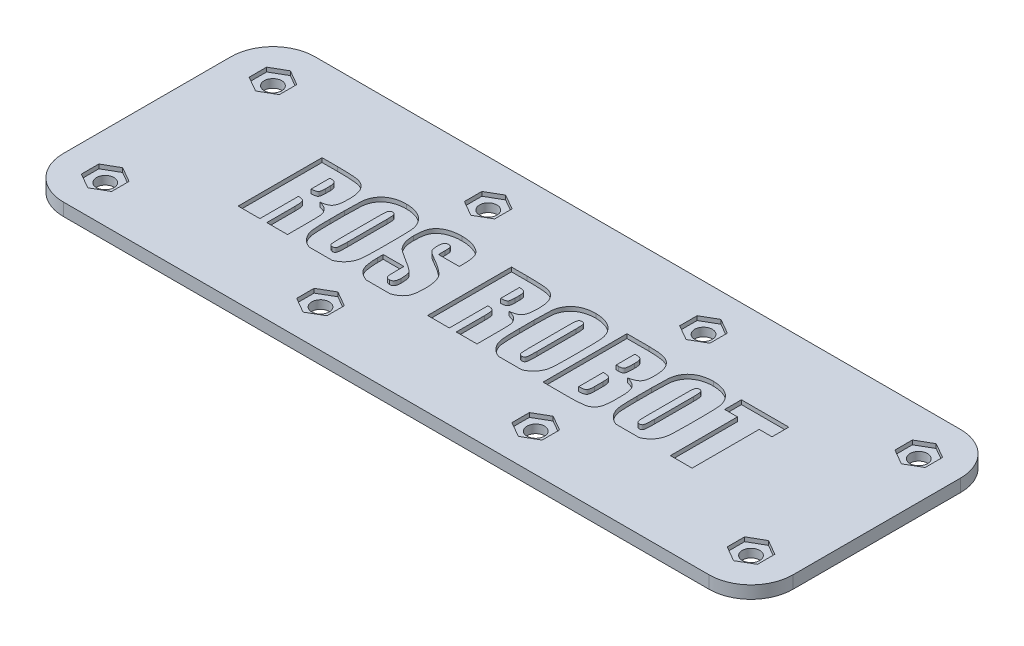
from build123d import *

# Parameters (mm, degrees)
SKETCH1_W           = 174
SKETCH1_H           = 60
BOSS_EXTRUDE1_DEPTH = 3
SKETCH2_R           = 2.09
CUT_EXTRUDE1_DEPTH  = 93.076055519
FILLET1_R           = 10
CUT_EXTRUDE2_DEPTH  = 1
CUT_EXTRUDE3_DEPTH  = 1


with BuildPart() as part:
    # Sketch1 → Boss-Extrude1 (new body)
    with BuildSketch(Plane(origin=(0, 0, 0), x_dir=(1, 0, 0), z_dir=(0, 1, 0))):
        Rectangle(SKETCH1_W, SKETCH1_H)
    extrude(amount=BOSS_EXTRUDE1_DEPTH)

    # Sketch2 → Cut-Extrude1 (cut, through all)
    with BuildSketch(Plane(origin=(0, 3, 0), x_dir=(1, 0, 0), z_dir=(0, 1, 0))):
        with Locations((-76.995, 20)):
            Circle(SKETCH2_R)
        with Locations((-25.665, 20)):
            Circle(SKETCH2_R)
        with Locations((25.665, 20)):
            Circle(SKETCH2_R)
        with Locations((76.995, 20)):
            Circle(SKETCH2_R)
    cut_extrude1 = extrude(amount=-CUT_EXTRUDE1_DEPTH, mode=Mode.SUBTRACT)

    # Mirror1: Cut-Extrude1 across plane
    add(cut_extrude1.mirror(Plane.XY), mode=Mode.SUBTRACT)

    # Fillet1
    fillet1_edges = [part.edges().sort_by_distance(p)[0] for p in [
        (-87, 1.5, 30),
        (87, 1.5, 30),
        (87, 1.5, -30),
        (-87, 1.5, -30),
    ]]
    fillet(fillet1_edges, radius=FILLET1_R)

    # Sketch3 → Cut-Extrude2 (cut)
    # profile 1 of 8: a face of its own
    with BuildSketch(Plane(origin=(0, 3, 0), x_dir=(1, 0, 0), z_dir=(0, 1, 0))):
        with BuildLine():
            Line((-55.294117647, 10), (-55.294117647, -10))
            Line((-55.294117647, -10), (-50.117647059, -10))
            Line((-50.117647059, -10), (-50.117647059, -0.823529412))
            add(Edge.make_bspline(
                [(-48.470588235, -3.235294118), (-48.472761242, -2.989057045), (-48.472387298, -2.639023284), (-48.505158342, -2.198133437), (-48.532479629, -1.92557618), (-48.569704298, -1.691279038), (-48.610487711, -1.495733015), (-48.665731057, -1.339045986), (-48.72892158, -1.214559745), (-48.811250352, -1.114048439), (-48.923249449, -1.039006456), (-49.055008244, -0.967790447), (-49.216553319, -0.913344326), (-49.404406892, -0.87518001), (-49.706887916, -0.834016934), (-49.948360167, -0.824906739), (-50.117647059, -0.823529412)],
                knots=[0, 0, 0, 0, 0.208712059, 0.296134584, 0.374433717, 0.440652749, 0.497064647, 0.543362023, 0.580977914, 0.614871505, 0.652040686, 0.69429784, 0.741574127, 0.795734674, 0.856514492, 1, 1, 1, 1], degree=3))
            Line((-48.470588235, -3.235294118), (-48.470588235, -10))
            Line((-48.470588235, -10), (-43.529411765, -10))
            Line((-43.529411765, -10), (-43.529411765, -4.658088235))
            add(Edge.make_bspline(
                [(-46.408088235, 0.573529412), (-46.169175195, 0.50822747), (-45.822797374, 0.415734606), (-45.392366575, 0.25367086), (-45.117566143, 0.123930771), (-44.870917189, -0.007492588), (-44.65785979, -0.150360385), (-44.475013905, -0.301624252), (-44.280128786, -0.508899378), (-44.084325942, -0.769865918), (-43.889130105, -1.074726742), (-43.748038737, -1.369657122), (-43.665206597, -1.619897087), (-43.628706333, -1.846302243), (-43.597806292, -2.071507013), (-43.579140796, -2.357697691), (-43.560358753, -2.703267668), (-43.546626536, -3.107776257), (-43.529565282, -3.765806928), (-43.534845869, -4.289262628), (-43.529411765, -4.658088235)],
                knots=[0, 0, 0, 0, 0.110230182, 0.159227155, 0.204340897, 0.245320208, 0.283417653, 0.318243371, 0.350628895, 0.409719639, 0.463107288, 0.511383408, 0.554826309, 0.579739697, 0.613274558, 0.655916727, 0.707227072, 0.767225961, 0.835926031, 1, 1, 1, 1], degree=3))
            add(Edge.make_bspline(
                [(-43.529411765, 4.617647059), (-43.523559379, 4.265343442), (-43.547444952, 3.759926021), (-43.602480895, 3.118174034), (-43.67103257, 2.70757313), (-43.748929488, 2.343067112), (-43.846868698, 2.023021074), (-43.966655354, 1.751430904), (-44.105783368, 1.520874413), (-44.274381424, 1.32692517), (-44.474656502, 1.156423758), (-44.713189671, 1.010798238), (-44.984161555, 0.881436662), (-45.289554301, 0.77180459), (-45.764929016, 0.650898651), (-46.14354858, 0.594911695), (-46.408088235, 0.573529412)],
                knots=[0, 0, 0, 0, 0.183790359, 0.264137372, 0.336086755, 0.400975565, 0.458649469, 0.51049186, 0.555594521, 0.598692018, 0.644079697, 0.692369191, 0.744168131, 0.800636925, 0.861471696, 1, 1, 1, 1], degree=3))
            add(Edge.make_bspline(
                [(-51.566176471, 10), (-50.993819944, 10.002073268), (-50.173782937, 9.992522011), (-49.130967301, 9.961770188), (-48.461579038, 9.934349846), (-47.867125834, 9.893765625), (-47.348485673, 9.846902044), (-46.905287107, 9.793813546), (-46.526534008, 9.727924289), (-46.192709029, 9.642203621), (-45.884608598, 9.529610049), (-45.589803188, 9.3956181), (-45.311726309, 9.228198446), (-45.052332013, 9.031642664), (-44.802348856, 8.815602269), (-44.574834978, 8.564597704), (-44.355921653, 8.290441128), (-44.158035206, 7.977684947), (-43.990685169, 7.6226227), (-43.847046859, 7.226287928), (-43.730527587, 6.786918244), (-43.640302786, 6.30511939), (-43.54780148, 5.579003966), (-43.534831682, 5.009887783), (-43.529411765, 4.617647059)],
                knots=[0, 0, 0, 0, 0.148881435, 0.213302999, 0.271376625, 0.323137581, 0.368275921, 0.406826982, 0.439217091, 0.468211877, 0.496345732, 0.524443445, 0.552325136, 0.580568943, 0.609027807, 0.638127546, 0.668547056, 0.700208954, 0.734143472, 0.770447799, 0.809729999, 0.852243566, 0.897872275, 1, 1, 1, 1], degree=3))
            Line((-51.566176471, 10), (-55.294117647, 10))
        make_face()
        with BuildLine():
            Line((-50.117647059, 2.235294118), (-50.117647059, 6.705882353))
            add(Edge.make_bspline(
                [(-48.470588235, 5.154411765), (-48.473249493, 5.418336948), (-48.491488459, 5.788234319), (-48.648984539, 6.208983424), (-48.813415334, 6.422021915), (-49.050216126, 6.552252293), (-49.479623299, 6.691331049), (-49.853765331, 6.700787332), (-50.117647059, 6.705882353)],
                knots=[0, 0, 0, 0, 0.296724354, 0.405999103, 0.497474067, 0.590179394, 0.702696619, 1, 1, 1, 1], degree=3))
            Line((-48.470588235, 5.154411765), (-48.470588235, 4.047794118))
            add(Edge.make_bspline(
                [(-50.117647059, 2.235294118), (-49.857557508, 2.233760348), (-49.495937601, 2.254180117), (-49.069683976, 2.35845805), (-48.867432147, 2.445644692), (-48.745704681, 2.557108502), (-48.667446357, 2.67024801), (-48.608188606, 2.82039897), (-48.557138221, 3.001544455), (-48.518214815, 3.215789117), (-48.475786771, 3.567218376), (-48.476158421, 3.849445469), (-48.470588235, 4.047794118)],
                knots=[0, 0, 0, 0, 0.263190412, 0.361520604, 0.442777778, 0.481272857, 0.526534855, 0.58025477, 0.643242407, 0.716208439, 0.799608844, 1, 1, 1, 1], degree=3))
        make_face(mode=Mode.SUBTRACT)
    # profile 2 of 8: a face of its own
    with BuildSketch(Plane(origin=(0, 3, 0), x_dir=(1, 0, 0), z_dir=(0, 1, 0))):
        Polygon((47.764705882, 6), (47.764705882, -10), (52.941176471, -10), (52.941176471, 6), (56, 6), (56, 10), (44.705882353, 10), (44.705882353, 6), align=None)
    # profile 3 of 8: a face of its own
    with BuildSketch(Plane(origin=(0, 3, 0), x_dir=(1, 0, 0), z_dir=(0, 1, 0))):
        with BuildLine():
            add(Edge.make_bspline(
                [(34.787591886, -10), (34.741761761, -9.982163901), (34.487009891, -9.879507335), (34.042846164, -9.665315535), (33.497596942, -9.294141109), (33.004837153, -8.868283302), (32.590244195, -8.369291591), (32.241200285, -7.832606995), (31.970326867, -7.264803658), (31.7770156, -6.675518554), (31.680811824, -6.158697296), (31.640781616, -5.707416893), (31.61144965, -5.309067923), (31.58644099, -4.851864522), (31.563600779, -4.338406349), (31.550537462, -3.765971588), (31.534960472, -2.887325956), (31.530709234, -2.198537053), (31.529411765, -1.720588235)],
                knots=[0.225245668, 0.225245668, 0.225245668, 0.225245668, 0.237119462, 0.291547555, 0.344026935, 0.396061673, 0.448382925, 0.500209986, 0.550407591, 0.599943185, 0.649656355, 0.677028621, 0.709391549, 0.746167788, 0.787661399, 0.833573904, 0.884512765, 1, 1, 1, 1], degree=3))
            Line((34.787591886, -10), (40.270546503, -10))
            add(Edge.make_bspline(
                [(43.529411765, -1.720588235), (43.524977386, -2.187493055), (43.527485684, -2.861564549), (43.513659007, -3.723176582), (43.492592589, -4.286757999), (43.477437693, -4.794372306), (43.450537902, -5.247761941), (43.421891662, -5.646171759), (43.380347347, -6.101647454), (43.294542618, -6.624914293), (43.107920451, -7.219511222), (42.843367666, -7.785177502), (42.511311791, -8.321353326), (42.105777244, -8.812589913), (41.63007521, -9.246149672), (41.088724326, -9.619888631), (40.6233363, -9.856872129), (40.342702819, -9.972014325), (40.270546503, -10)],
                knots=[0, 0, 0, 0, 0.112808662, 0.162854343, 0.208179017, 0.249065094, 0.285542064, 0.317901769, 0.345566, 0.396043361, 0.445675688, 0.495616157, 0.546553387, 0.597655569, 0.64900077, 0.701564226, 0.756120432, 0.774811337, 0.774811337, 0.774811337, 0.774811337], degree=3))
            Line((43.529411765, -1.720588235), (43.529411765, 1.720588235))
            add(Edge.make_bspline(
                [(37.529411765, 10.470588235), (38.038894684, 10.469671201), (38.788681402, 10.412760966), (39.744529245, 10.186217725), (40.401636425, 9.955436447), (41.013529114, 9.66465689), (41.560592921, 9.296369489), (42.050185177, 8.866806687), (42.465386921, 8.369636901), (42.81304053, 7.831558235), (43.089397703, 7.265823377), (43.281884485, 6.674250061), (43.378475362, 6.156263525), (43.416575366, 5.70476117), (43.453946296, 5.308199355), (43.470219128, 4.85167531), (43.496202826, 4.338451088), (43.506675236, 3.76590889), (43.533077201, 2.887460762), (43.521820892, 2.198445293), (43.529411765, 1.720588235)],
                knots=[0, 0, 0, 0, 0.123202067, 0.180742519, 0.236944207, 0.291252849, 0.34398818, 0.39581077, 0.448142032, 0.499979007, 0.550314461, 0.599859532, 0.649873316, 0.677250819, 0.709347809, 0.74611558, 0.787617129, 0.833538417, 0.884493047, 1, 1, 1, 1], degree=3))
            add(Edge.make_bspline(
                [(31.529411765, 1.720588235), (31.533991052, 2.188713716), (31.531108159, 2.862798648), (31.545386018, 3.724392091), (31.565702585, 4.286786515), (31.583100426, 4.795440173), (31.603076752, 5.249142813), (31.633848772, 5.647343808), (31.67399175, 6.101980465), (31.765594143, 6.624508136), (31.95074402, 7.219419898), (32.214264902, 7.784810836), (32.550091288, 8.318154077), (32.951446724, 8.814087979), (33.43222548, 9.243388483), (33.97014504, 9.621689493), (34.57743305, 9.926923969), (35.239660206, 10.175524458), (36.224684229, 10.407114958), (36.999322768, 10.475980227), (37.529411765, 10.470588235)],
                knots=[0, 0, 0, 0, 0.113099886, 0.162847397, 0.208170127, 0.249054449, 0.28580995, 0.317873, 0.345536044, 0.396062444, 0.445692641, 0.495630967, 0.546314995, 0.597643479, 0.649205395, 0.701523382, 0.756077247, 0.812941755, 0.872040704, 1, 1, 1, 1], degree=3))
            Line((31.529411765, 1.720588235), (31.529411765, -1.720588235))
        make_face()
        with BuildLine():
            Line((36.705882353, -4.566176471), (36.705882353, 4.959558824))
            add(Edge.make_bspline(
                [(37.555147059, 7.176470588), (37.428868031, 7.182797441), (37.24390046, 7.138559035), (37.035758608, 7.000683728), (36.931909138, 6.877108883), (36.862948919, 6.744569909), (36.822456095, 6.603411175), (36.785646052, 6.425261242), (36.758957365, 6.207467331), (36.73117098, 5.951569919), (36.715299821, 5.530700778), (36.703487212, 5.196283974), (36.705882353, 4.959558824)],
                knots=[0, 0, 0, 0, 0.141272891, 0.207933505, 0.278501019, 0.320511285, 0.375555263, 0.443280697, 0.525522512, 0.622694993, 0.733336158, 1, 1, 1, 1], degree=3))
            add(Edge.make_bspline(
                [(38.352941176, 4.959558824), (38.352264386, 5.175303354), (38.346448336, 5.482932653), (38.333448647, 5.871602904), (38.314251231, 6.115480155), (38.292601849, 6.32757554), (38.26906515, 6.508580133), (38.235892117, 6.655852623), (38.190248925, 6.805984555), (38.106307017, 6.954005969), (37.907812734, 7.143059215), (37.690491789, 7.172463444), (37.555147059, 7.176470588)],
                knots=[0, 0, 0, 0, 0.245381507, 0.350013726, 0.44228014, 0.523562531, 0.592561096, 0.649714338, 0.695120491, 0.770678918, 0.840725622, 1, 1, 1, 1], degree=3))
            Line((38.352941176, 4.959558824), (38.352941176, -4.415441176))
            add(Edge.make_bspline(
                [(37.518382353, -7.176470588), (37.66995262, -7.179093019), (37.905890797, -7.129538142), (38.118964553, -6.90767097), (38.197795186, -6.727494998), (38.244746358, -6.545832046), (38.270782318, -6.363169473), (38.296907257, -6.140135689), (38.319120243, -5.875330263), (38.331807954, -5.568704581), (38.347878308, -5.07734288), (38.351487943, -4.688733938), (38.352941176, -4.415441176)],
                knots=[0, 0, 0, 0, 0.145035585, 0.209346918, 0.281953002, 0.327186926, 0.385477675, 0.455016533, 0.53818829, 0.634996402, 0.743261766, 1, 1, 1, 1], degree=3))
            add(Edge.make_bspline(
                [(36.705882353, -4.566176471), (36.710406485, -4.834553498), (36.707612663, -5.215756676), (36.721256936, -5.695131762), (36.742396681, -5.990199181), (36.757088503, -6.243241553), (36.783640941, -6.454082367), (36.811484319, -6.62251498), (36.851258818, -6.78643941), (36.933796701, -6.945563097), (37.144434325, -7.143111825), (37.373741892, -7.175688722), (37.518382353, -7.176470588)],
                knots=[0, 0, 0, 0, 0.263965983, 0.374910105, 0.471520145, 0.554902094, 0.624118814, 0.680393612, 0.722784308, 0.789641701, 0.853612109, 1, 1, 1, 1], degree=3))
        make_face(mode=Mode.SUBTRACT)
    # profile 4 of 8: a face of its own
    with BuildSketch(Plane(origin=(0, 3, 0), x_dir=(1, 0, 0), z_dir=(0, 1, 0))):
        with BuildLine():
            Line((17.411764706, 10), (17.411764706, -10))
            Line((17.411764706, -10), (23.492647059, -10))
            add(Edge.make_bspline(
                [(29.647058824, -5.242647059), (29.646934914, -5.56266215), (29.63497194, -6.026795982), (29.584977204, -6.622276843), (29.53416178, -7.01986255), (29.468709895, -7.384541811), (29.388508503, -7.716304337), (29.293798242, -8.015418252), (29.149573113, -8.363197067), (28.927560807, -8.74691581), (28.580556243, -9.13068276), (28.16551384, -9.437763787), (27.757437565, -9.624746944), (27.37556001, -9.732935722), (27.017915035, -9.80554901), (26.59446752, -9.866667644), (26.10218982, -9.911528453), (25.545803904, -9.952303985), (24.668406884, -9.993965557), (23.976672129, -9.994581299), (23.492647059, -10)],
                knots=[0, 0, 0, 0, 0.102249571, 0.148224941, 0.190863369, 0.230259752, 0.266534441, 0.299841642, 0.330380545, 0.386717901, 0.440498022, 0.494529809, 0.550587574, 0.582802206, 0.621195561, 0.667097519, 0.719418425, 0.779085769, 0.845327487, 1, 1, 1, 1], degree=3))
            Line((29.647058824, -5.242647059), (29.647058824, -3.363970588))
            add(Edge.make_bspline(
                [(26.632352941, 0.941176471), (26.906401285, 0.878367085), (27.300653812, 0.765704813), (27.787692795, 0.562963036), (28.106692167, 0.402419875), (28.388685462, 0.220959582), (28.635442208, 0.022849809), (28.848962578, -0.191232265), (29.023773677, -0.428407061), (29.173198265, -0.68773403), (29.30233921, -0.975620533), (29.406624653, -1.296799727), (29.495483711, -1.649218696), (29.564266695, -2.032454679), (29.628905941, -2.607265288), (29.645716704, -3.054823478), (29.647058824, -3.363970588)],
                knots=[0, 0, 0, 0, 0.144065397, 0.209341867, 0.269975095, 0.326732211, 0.380743663, 0.431785064, 0.481119172, 0.531178616, 0.584838818, 0.642398889, 0.703899801, 0.770874214, 0.841643912, 1, 1, 1, 1], degree=3))
            add(Edge.make_bspline(
                [(29.411764706, 4.393382353), (29.416072307, 4.126960997), (29.396065876, 3.74315812), (29.335162444, 3.256001615), (29.279024495, 2.936656591), (29.198004913, 2.651763218), (29.102620539, 2.397408381), (28.989683638, 2.175311926), (28.854039324, 1.981642317), (28.690429234, 1.812181884), (28.495593314, 1.657001481), (28.269341956, 1.510833787), (28.006048053, 1.37965403), (27.71371462, 1.248439101), (27.252486443, 1.096633591), (26.888805185, 0.993582451), (26.632352941, 0.941176471)],
                knots=[0, 0, 0, 0, 0.159593497, 0.229911515, 0.294149678, 0.353664097, 0.407125896, 0.456720642, 0.50256341, 0.548270697, 0.597357213, 0.651540418, 0.709344876, 0.773469607, 0.843372266, 1, 1, 1, 1], degree=3))
            add(Edge.make_bspline(
                [(22.716911765, 10), (23.110299522, 9.995507602), (23.681885346, 9.991990426), (24.418574897, 9.952815753), (24.913450102, 9.906680869), (25.371467166, 9.85836305), (25.790704796, 9.791308442), (26.172459453, 9.715347075), (26.520787705, 9.627485478), (26.84146812, 9.519137488), (27.144180179, 9.391831518), (27.429336701, 9.235748238), (27.697604709, 9.054575482), (27.953304968, 8.851805073), (28.191702458, 8.62386534), (28.413756391, 8.371324932), (28.621706622, 8.093999736), (28.812626294, 7.782522973), (28.973440584, 7.426443305), (29.107426233, 7.026703693), (29.222906801, 6.585043099), (29.303426476, 6.098623186), (29.390288895, 5.365364626), (29.415704121, 4.790976826), (29.411764706, 4.393382353)],
                knots=[0, 0, 0, 0, 0.114402272, 0.166147642, 0.214440873, 0.258905608, 0.300029633, 0.337835121, 0.3720588, 0.404397908, 0.436166631, 0.467419606, 0.498747648, 0.530188964, 0.562196583, 0.594510161, 0.627862043, 0.662877889, 0.700506647, 0.74118522, 0.785347679, 0.833090934, 0.884403879, 1, 1, 1, 1], degree=3))
            Line((22.716911765, 10), (17.411764706, 10))
        make_face()
        with BuildLine():
            Line((22.588235294, -6.705882353), (22.588235294, -0.823529412))
            add(Edge.make_bspline(
                [(24.470588235, -2.783088235), (24.469862246, -2.581049271), (24.468263551, -2.292776904), (24.427029649, -1.932486797), (24.404272556, -1.709794577), (24.356722032, -1.522790473), (24.308770024, -1.366819262), (24.246387911, -1.243993471), (24.173743985, -1.146988974), (24.074721587, -1.077498638), (23.954129928, -1.015414588), (23.799805517, -0.965596267), (23.616507623, -0.922557764), (23.402762748, -0.886516164), (23.057457797, -0.845450875), (22.782095648, -0.830589633), (22.588235294, -0.823529412)],
                knots=[0, 0, 0, 0, 0.182450376, 0.259089149, 0.327073499, 0.383894219, 0.4328162, 0.473836669, 0.507662291, 0.540813339, 0.581833808, 0.629708737, 0.686529456, 0.751567122, 0.825033248, 1, 1, 1, 1], degree=3))
            Line((24.470588235, -2.783088235), (24.470588235, -4.746323529))
            add(Edge.make_bspline(
                [(22.588235294, -6.705882353), (22.772111176, -6.697406963), (23.035946818, -6.686457893), (23.366082308, -6.639035107), (23.574317755, -6.600446567), (23.754734821, -6.548534402), (23.909241043, -6.49114772), (24.037582, -6.426347928), (24.139518515, -6.345276863), (24.219828968, -6.242534291), (24.290452462, -6.116974085), (24.343026299, -5.957931043), (24.390391907, -5.772581816), (24.426658548, -5.55735456), (24.460433346, -5.212848849), (24.475325771, -4.93910161), (24.470588235, -4.746323529)],
                knots=[0, 0, 0, 0, 0.168587072, 0.241054147, 0.305044923, 0.362185481, 0.412580102, 0.455716051, 0.493190485, 0.530664919, 0.574336739, 0.624343173, 0.683356267, 0.749349201, 0.823767794, 1, 1, 1, 1], degree=3))
        make_face(mode=Mode.SUBTRACT)
        with BuildLine():
            Line((22.588235294, 2.235294118), (22.588235294, 6.705882353))
            add(Edge.make_bspline(
                [(24.470588235, 4.794117647), (24.472484496, 5.063219136), (24.456102942, 5.432680133), (24.377118595, 5.876003573), (24.290960876, 6.108918073), (24.185117865, 6.287925027), (24.065630734, 6.427443722), (23.932108439, 6.534581277), (23.771096212, 6.604626256), (23.56915719, 6.646964309), (23.171954505, 6.69359434), (22.835840675, 6.701690154), (22.588235294, 6.705882353)],
                knots=[0, 0, 0, 0, 0.247893338, 0.340015611, 0.413628261, 0.475403061, 0.530639967, 0.582137883, 0.631666993, 0.690827129, 0.771639487, 1, 1, 1, 1], degree=3))
            add(Edge.make_bspline(
                [(23.161764706, 2.246323529), (23.394028214, 2.2431048), (23.720403071, 2.271138301), (24.083618428, 2.440239428), (24.230880072, 2.592576437), (24.301784115, 2.75375132), (24.348188684, 2.915615042), (24.382075121, 3.121889263), (24.415674107, 3.370608152), (24.440054223, 3.665115429), (24.465440646, 4.144235023), (24.470464317, 4.52570717), (24.470588235, 4.794117647)],
                knots=[0, 0, 0, 0, 0.207123309, 0.283931547, 0.350841284, 0.389256939, 0.439128512, 0.499893306, 0.574453467, 0.661745219, 0.761896218, 1, 1, 1, 1], degree=3))
            add(Edge.make_bspline(
                [(22.588235294, 2.235294118), (22.874959549, 2.242972169), (23.161764706, 2.246323529)],
                knots=[0, 0, 0, 1, 1, 1], degree=2))
        make_face(mode=Mode.SUBTRACT)
    # profile 5 of 8: a face of its own
    with BuildSketch(Plane(origin=(0, 3, 0), x_dir=(1, 0, 0), z_dir=(0, 1, 0))):
        with BuildLine():
            add(Edge.make_bspline(
                [(6.787591886, -10), (6.741761761, -9.982163901), (6.487009891, -9.879507335), (6.042846164, -9.665315535), (5.497596942, -9.294141109), (5.004837153, -8.868283302), (4.590244195, -8.369291591), (4.241200285, -7.832606995), (3.970326867, -7.264803658), (3.7770156, -6.675518554), (3.680811824, -6.158697296), (3.640781616, -5.707416893), (3.61144965, -5.309067923), (3.58644099, -4.851864522), (3.563600779, -4.338406349), (3.550537462, -3.765971588), (3.534960472, -2.887325956), (3.530709234, -2.198537053), (3.529411765, -1.720588235)],
                knots=[0.225245668, 0.225245668, 0.225245668, 0.225245668, 0.237119462, 0.291547555, 0.344026935, 0.396061673, 0.448382925, 0.500209986, 0.550407591, 0.599943185, 0.649656355, 0.677028621, 0.709391549, 0.746167788, 0.787661399, 0.833573904, 0.884512765, 1, 1, 1, 1], degree=3))
            Line((6.787591886, -10), (12.270546503, -10))
            add(Edge.make_bspline(
                [(15.529411765, -1.720588235), (15.524977386, -2.187493055), (15.527485684, -2.861564549), (15.513659007, -3.723176582), (15.492592589, -4.286757999), (15.477437693, -4.794372306), (15.450537902, -5.247761941), (15.421891662, -5.646171759), (15.380347347, -6.101647454), (15.294542618, -6.624914293), (15.107920451, -7.219511222), (14.843367666, -7.785177502), (14.511311791, -8.321353326), (14.105777244, -8.812589913), (13.63007521, -9.246149672), (13.088724326, -9.619888631), (12.6233363, -9.856872129), (12.342702819, -9.972014325), (12.270546503, -10)],
                knots=[0, 0, 0, 0, 0.112808662, 0.162854343, 0.208179017, 0.249065094, 0.285542064, 0.317901769, 0.345566, 0.396043361, 0.445675688, 0.495616157, 0.546553387, 0.597655569, 0.64900077, 0.701564226, 0.756120432, 0.774811337, 0.774811337, 0.774811337, 0.774811337], degree=3))
            Line((15.529411765, -1.720588235), (15.529411765, 1.720588235))
            add(Edge.make_bspline(
                [(9.529411765, 10.470588235), (10.038894684, 10.469671201), (10.788681402, 10.412760966), (11.744529245, 10.186217725), (12.401636425, 9.955436447), (13.013529114, 9.66465689), (13.560592921, 9.296369489), (14.050185177, 8.866806687), (14.465386921, 8.369636901), (14.81304053, 7.831558235), (15.089397703, 7.265823377), (15.281884485, 6.674250061), (15.378475362, 6.156263525), (15.416575366, 5.70476117), (15.453946296, 5.308199355), (15.470219128, 4.85167531), (15.496202826, 4.338451088), (15.506675236, 3.76590889), (15.533077201, 2.887460762), (15.521820892, 2.198445293), (15.529411765, 1.720588235)],
                knots=[0, 0, 0, 0, 0.123202067, 0.180742519, 0.236944207, 0.291252849, 0.34398818, 0.39581077, 0.448142032, 0.499979007, 0.550314461, 0.599859532, 0.649873316, 0.677250819, 0.709347809, 0.74611558, 0.787617129, 0.833538417, 0.884493047, 1, 1, 1, 1], degree=3))
            add(Edge.make_bspline(
                [(3.529411765, 1.720588235), (3.533991052, 2.188713716), (3.531108159, 2.862798648), (3.545386018, 3.724392091), (3.565702585, 4.286786515), (3.583100426, 4.795440173), (3.603076752, 5.249142813), (3.633848772, 5.647343808), (3.67399175, 6.101980465), (3.765594143, 6.624508136), (3.95074402, 7.219419898), (4.214264902, 7.784810836), (4.550091288, 8.318154077), (4.951446724, 8.814087979), (5.43222548, 9.243388483), (5.97014504, 9.621689493), (6.57743305, 9.926923969), (7.239660206, 10.175524458), (8.224684229, 10.407114958), (8.999322768, 10.475980227), (9.529411765, 10.470588235)],
                knots=[0, 0, 0, 0, 0.113099886, 0.162847397, 0.208170127, 0.249054449, 0.28580995, 0.317873, 0.345536044, 0.396062444, 0.445692641, 0.495630967, 0.546314995, 0.597643479, 0.649205395, 0.701523382, 0.756077247, 0.812941755, 0.872040704, 1, 1, 1, 1], degree=3))
            Line((3.529411765, 1.720588235), (3.529411765, -1.720588235))
        make_face()
        with BuildLine():
            Line((8.705882353, -4.566176471), (8.705882353, 4.959558824))
            add(Edge.make_bspline(
                [(9.555147059, 7.176470588), (9.428868031, 7.182797441), (9.24390046, 7.138559035), (9.035758608, 7.000683728), (8.931909138, 6.877108883), (8.862948919, 6.744569909), (8.822456095, 6.603411175), (8.785646052, 6.425261242), (8.758957365, 6.207467331), (8.73117098, 5.951569919), (8.715299821, 5.530700778), (8.703487212, 5.196283974), (8.705882353, 4.959558824)],
                knots=[0, 0, 0, 0, 0.141272891, 0.207933505, 0.278501019, 0.320511285, 0.375555263, 0.443280697, 0.525522512, 0.622694993, 0.733336158, 1, 1, 1, 1], degree=3))
            add(Edge.make_bspline(
                [(10.352941176, 4.959558824), (10.352264386, 5.175303354), (10.346448336, 5.482932653), (10.333448647, 5.871602904), (10.314251231, 6.115480155), (10.292601849, 6.32757554), (10.26906515, 6.508580133), (10.235892117, 6.655852623), (10.190248925, 6.805984555), (10.106307017, 6.954005969), (9.907812734, 7.143059215), (9.690491789, 7.172463444), (9.555147059, 7.176470588)],
                knots=[0, 0, 0, 0, 0.245381507, 0.350013726, 0.44228014, 0.523562531, 0.592561096, 0.649714338, 0.695120491, 0.770678918, 0.840725622, 1, 1, 1, 1], degree=3))
            Line((10.352941176, 4.959558824), (10.352941176, -4.415441176))
            add(Edge.make_bspline(
                [(9.518382353, -7.176470588), (9.66995262, -7.179093019), (9.905890797, -7.129538142), (10.118964553, -6.90767097), (10.197795186, -6.727494998), (10.244746358, -6.545832046), (10.270782318, -6.363169473), (10.296907257, -6.140135689), (10.319120243, -5.875330263), (10.331807954, -5.568704581), (10.347878308, -5.07734288), (10.351487943, -4.688733938), (10.352941176, -4.415441176)],
                knots=[0, 0, 0, 0, 0.145035585, 0.209346918, 0.281953002, 0.327186926, 0.385477675, 0.455016533, 0.53818829, 0.634996402, 0.743261766, 1, 1, 1, 1], degree=3))
            add(Edge.make_bspline(
                [(8.705882353, -4.566176471), (8.710406485, -4.834553498), (8.707612663, -5.215756676), (8.721256936, -5.695131762), (8.742396681, -5.990199181), (8.757088503, -6.243241553), (8.783640941, -6.454082367), (8.811484319, -6.62251498), (8.851258818, -6.78643941), (8.933796701, -6.945563097), (9.144434325, -7.143111825), (9.373741892, -7.175688722), (9.518382353, -7.176470588)],
                knots=[0, 0, 0, 0, 0.263965983, 0.374910105, 0.471520145, 0.554902094, 0.624118814, 0.680393612, 0.722784308, 0.789641701, 0.853612109, 1, 1, 1, 1], degree=3))
        make_face(mode=Mode.SUBTRACT)
    # profile 6 of 8: a face of its own
    with BuildSketch(Plane(origin=(0, 3, 0), x_dir=(1, 0, 0), z_dir=(0, 1, 0))):
        with BuildLine():
            Line((-10.117647059, 10), (-10.117647059, -10))
            Line((-10.117647059, -10), (-4.941176471, -10))
            Line((-4.941176471, -10), (-4.941176471, -0.823529412))
            add(Edge.make_bspline(
                [(-3.294117647, -3.235294118), (-3.296290654, -2.989057045), (-3.295916709, -2.639023284), (-3.328687754, -2.198133437), (-3.356009041, -1.92557618), (-3.39323371, -1.691279038), (-3.434017123, -1.495733015), (-3.489260469, -1.339045986), (-3.552450992, -1.214559745), (-3.634779763, -1.114048439), (-3.74677886, -1.039006456), (-3.878537656, -0.967790447), (-4.040082731, -0.913344326), (-4.227936304, -0.87518001), (-4.530417327, -0.834016934), (-4.771889579, -0.824906739), (-4.941176471, -0.823529412)],
                knots=[0, 0, 0, 0, 0.208712059, 0.296134584, 0.374433717, 0.440652749, 0.497064647, 0.543362023, 0.580977914, 0.614871505, 0.652040686, 0.69429784, 0.741574127, 0.795734674, 0.856514492, 1, 1, 1, 1], degree=3))
            Line((-3.294117647, -3.235294118), (-3.294117647, -10))
            Line((-3.294117647, -10), (1.647058824, -10))
            Line((1.647058824, -10), (1.647058824, -4.658088235))
            add(Edge.make_bspline(
                [(-1.231617647, 0.573529412), (-0.992704607, 0.50822747), (-0.646326786, 0.415734606), (-0.215895987, 0.25367086), (0.058904445, 0.123930771), (0.3055534, -0.007492588), (0.518610798, -0.150360385), (0.701456683, -0.301624252), (0.896341803, -0.508899378), (1.092144646, -0.769865918), (1.287340483, -1.074726742), (1.428431851, -1.369657122), (1.511263992, -1.619897087), (1.547764255, -1.846302243), (1.578664296, -2.071507013), (1.597329792, -2.357697691), (1.616111835, -2.703267668), (1.629844053, -3.107776257), (1.646905306, -3.765806928), (1.641624719, -4.289262628), (1.647058824, -4.658088235)],
                knots=[0, 0, 0, 0, 0.110230182, 0.159227155, 0.204340897, 0.245320208, 0.283417653, 0.318243371, 0.350628895, 0.409719639, 0.463107288, 0.511383408, 0.554826309, 0.579739697, 0.613274558, 0.655916727, 0.707227072, 0.767225961, 0.835926031, 1, 1, 1, 1], degree=3))
            add(Edge.make_bspline(
                [(1.647058824, 4.617647059), (1.652911209, 4.265343442), (1.629025636, 3.759926021), (1.573989693, 3.118174034), (1.505438018, 2.70757313), (1.4275411, 2.343067112), (1.32960189, 2.023021074), (1.209815234, 1.751430904), (1.070687221, 1.520874413), (0.902089165, 1.32692517), (0.701814086, 1.156423758), (0.463280917, 1.010798238), (0.192309033, 0.881436662), (-0.113083713, 0.77180459), (-0.588458428, 0.650898651), (-0.967077992, 0.594911695), (-1.231617647, 0.573529412)],
                knots=[0, 0, 0, 0, 0.183790359, 0.264137372, 0.336086755, 0.400975565, 0.458649469, 0.51049186, 0.555594521, 0.598692018, 0.644079697, 0.692369191, 0.744168131, 0.800636925, 0.861471696, 1, 1, 1, 1], degree=3))
            add(Edge.make_bspline(
                [(-6.389705882, 10), (-5.817349355, 10.002073268), (-4.997312349, 9.992522011), (-3.954496712, 9.961770188), (-3.28510845, 9.934349846), (-2.690655246, 9.893765625), (-2.172015085, 9.846902044), (-1.728816518, 9.793813546), (-1.35006342, 9.727924289), (-1.016238441, 9.642203621), (-0.70813801, 9.529610049), (-0.4133326, 9.3956181), (-0.135255721, 9.228198446), (0.124138575, 9.031642664), (0.374121732, 8.815602269), (0.60163561, 8.564597704), (0.820548935, 8.290441128), (1.018435383, 7.977684947), (1.185785419, 7.6226227), (1.329423729, 7.226287928), (1.445943001, 6.786918244), (1.536167802, 6.30511939), (1.628669108, 5.579003966), (1.641638907, 5.009887783), (1.647058824, 4.617647059)],
                knots=[0, 0, 0, 0, 0.148881435, 0.213302999, 0.271376625, 0.323137581, 0.368275921, 0.406826982, 0.439217091, 0.468211877, 0.496345732, 0.524443445, 0.552325136, 0.580568943, 0.609027807, 0.638127546, 0.668547056, 0.700208954, 0.734143472, 0.770447799, 0.809729999, 0.852243566, 0.897872275, 1, 1, 1, 1], degree=3))
            Line((-6.389705882, 10), (-10.117647059, 10))
        make_face()
        with BuildLine():
            Line((-4.941176471, 2.235294118), (-4.941176471, 6.705882353))
            add(Edge.make_bspline(
                [(-3.294117647, 5.154411765), (-3.296778905, 5.418336948), (-3.315017871, 5.788234319), (-3.472513951, 6.208983424), (-3.636944745, 6.422021915), (-3.873745538, 6.552252293), (-4.303152711, 6.691331049), (-4.677294743, 6.700787332), (-4.941176471, 6.705882353)],
                knots=[0, 0, 0, 0, 0.296724354, 0.405999103, 0.497474067, 0.590179394, 0.702696619, 1, 1, 1, 1], degree=3))
            Line((-3.294117647, 5.154411765), (-3.294117647, 4.047794118))
            add(Edge.make_bspline(
                [(-4.941176471, 2.235294118), (-4.681086919, 2.233760348), (-4.319467013, 2.254180117), (-3.893213388, 2.35845805), (-3.690961559, 2.445644692), (-3.569234093, 2.557108502), (-3.490975769, 2.67024801), (-3.431718018, 2.82039897), (-3.380667632, 3.001544455), (-3.341744227, 3.215789117), (-3.299316183, 3.567218376), (-3.299687833, 3.849445469), (-3.294117647, 4.047794118)],
                knots=[0, 0, 0, 0, 0.263190412, 0.361520604, 0.442777778, 0.481272857, 0.526534855, 0.58025477, 0.643242407, 0.716208439, 0.799608844, 1, 1, 1, 1], degree=3))
        make_face(mode=Mode.SUBTRACT)
    # profile 7 of 8: a face of its own
    with BuildSketch(Plane(origin=(0, 3, 0), x_dir=(1, 0, 0), z_dir=(0, 1, 0))):
        with BuildLine():
            add(Edge.make_bspline(
                [(-24.797933292, -10), (-24.921932393, -9.95471233), (-25.178630769, -9.853998955), (-25.549413404, -9.667641606), (-25.909341849, -9.459149009), (-26.239594792, -9.236779668), (-26.536792154, -8.999076642), (-26.802666174, -8.749624779), (-27.036252757, -8.484168872), (-27.233897492, -8.202723929), (-27.407075044, -7.912631545), (-27.539510276, -7.599452016), (-27.648684303, -7.26533218), (-27.746477149, -6.902596374), (-27.819338969, -6.506054533), (-27.887643483, -6.077356452), (-27.937301298, -5.615945519), (-27.98785038, -4.93600571), (-27.999768306, -4.409440994), (-28, -4.047794118)],
                knots=[0.286183202, 0.286183202, 0.286183202, 0.286183202, 0.324626854, 0.366463546, 0.406943511, 0.445764357, 0.48234487, 0.51770616, 0.551866298, 0.585155068, 0.617796039, 0.650099364, 0.683972791, 0.720174947, 0.759459361, 0.801373688, 0.846639763, 0.894618483, 1, 1, 1, 1], degree=3))
            Line((-24.797933292, -10), (-19.023347482, -10))
            add(Edge.make_bspline(
                [(-16, -4.875), (-15.998014857, -5.212265147), (-16.014101673, -5.701000746), (-16.069510311, -6.326928981), (-16.122472292, -6.743414513), (-16.196896507, -7.123612972), (-16.283689692, -7.469046697), (-16.385871847, -7.780925616), (-16.507930807, -8.061015007), (-16.654822165, -8.317315274), (-16.830122643, -8.557450899), (-17.032306907, -8.789565117), (-17.265554656, -9.010265677), (-17.528122043, -9.221337336), (-17.822490556, -9.417622448), (-18.145436019, -9.60646373), (-18.543697705, -9.810536832), (-18.843273457, -9.934229978), (-19.023347482, -10)],
                knots=[0, 0, 0, 0, 0.107306702, 0.155458913, 0.199906966, 0.240819393, 0.278648167, 0.313173616, 0.345123698, 0.375689955, 0.406966721, 0.43957622, 0.473499712, 0.509002183, 0.546637541, 0.585960101, 0.627987093, 0.68893065, 0.68893065, 0.68893065, 0.68893065], degree=3))
            add(Edge.make_bspline(
                [(-16.9375, -0.566176471), (-16.77003858, -0.806043702), (-16.558891693, -1.211465721), (-16.357268829, -1.810580448), (-16.225991682, -2.324256078), (-16.123687479, -2.890649038), (-16.024389707, -3.744627839), (-15.999987273, -4.413744653), (-16, -4.875)],
                knots=[0, 0, 0, 0, 0.19599711, 0.304678492, 0.423526134, 0.551406495, 0.69050554, 1, 1, 1, 1], degree=3))
            add(Edge.make_bspline(
                [(-21.529411765, 2.783088235), (-20.970305965, 2.473367773), (-20.172909867, 2.018375264), (-19.189740388, 1.388063598), (-18.573813667, 0.956308764), (-18.038870295, 0.552231412), (-17.480460132, 0.067679288), (-17.119384349, -0.302443276), (-16.9375, -0.566176471)],
                knots=[0, 0, 0, 0, 0.335277756, 0.481299959, 0.612364063, 0.729738585, 0.83271341, 1, 1, 1, 1], degree=3))
            add(Edge.make_bspline(
                [(-23.044117647, 4.007352941), (-22.995337919, 3.908726816), (-22.89204074, 3.763485988), (-22.716456053, 3.578339598), (-22.539134867, 3.431720611), (-22.334418219, 3.274066191), (-21.999638416, 3.049218613), (-21.722308394, 2.892754352), (-21.529411765, 2.783088235)],
                knots=[0, 0, 0, 0, 0.16675308, 0.269572473, 0.387215686, 0.516181657, 0.662459423, 1, 1, 1, 1], degree=3))
            add(Edge.make_bspline(
                [(-23.294117647, 5.573529412), (-23.296326908, 5.268536496), (-23.266606811, 4.735456987), (-23.143358219, 4.213860364), (-23.044117647, 4.007352941)],
                knots=[0, 0, 0, 0, 0.572651319, 1, 1, 1, 1], degree=3))
            add(Edge.make_bspline(
                [(-22.272058824, 7.176470588), (-22.422382216, 7.175318321), (-22.652559624, 7.133916453), (-22.898626556, 6.956363272), (-23.049357016, 6.777858689), (-23.163822977, 6.547345801), (-23.266997244, 6.142731079), (-23.300706927, 5.81087743), (-23.294117647, 5.573529412)],
                knots=[0, 0, 0, 0, 0.212113464, 0.31285869, 0.41856281, 0.535755935, 0.669150346, 1, 1, 1, 1], degree=3))
            add(Edge.make_bspline(
                [(-21.411764706, 5.463235294), (-21.412660836, 5.76472571), (-21.419668964, 6.171441157), (-21.505234267, 6.643084782), (-21.592726876, 6.863837137), (-21.719331543, 7.011621902), (-21.93796031, 7.146205292), (-22.136537492, 7.180330892), (-22.272058824, 7.176470588)],
                knots=[0, 0, 0, 0, 0.412842651, 0.553103389, 0.653610262, 0.733180376, 0.814494127, 1, 1, 1, 1], degree=3))
            Line((-21.411764706, 5.463235294), (-21.411764706, 3.882352941))
            Line((-21.411764706, 3.882352941), (-16.470588235, 3.882352941))
            Line((-16.470588235, 3.882352941), (-16.470588235, 4.6875))
            add(Edge.make_bspline(
                [(-22.433823529, 10.470588235), (-22.099355515, 10.465692072), (-21.605258314, 10.457850903), (-20.964766066, 10.377003258), (-20.510624153, 10.311996602), (-20.077185548, 10.213326449), (-19.66128427, 10.101842278), (-19.265923032, 9.964972533), (-18.892354157, 9.80679878), (-18.543176622, 9.63523955), (-18.21927313, 9.457507477), (-17.933690102, 9.258320673), (-17.668603796, 9.061328877), (-17.446057148, 8.839147392), (-17.242755176, 8.616987473), (-17.078595902, 8.376988569), (-16.940479561, 8.122327535), (-16.830854918, 7.838398109), (-16.730671215, 7.519755184), (-16.652900473, 7.154877719), (-16.581526247, 6.748162273), (-16.532829806, 6.294893947), (-16.481907954, 5.603934437), (-16.470960066, 5.062596294), (-16.470588235, 4.6875)],
                knots=[0, 0, 0, 0, 0.103080501, 0.151693764, 0.19864086, 0.244219301, 0.288418896, 0.331125316, 0.372879908, 0.413199037, 0.450863398, 0.486435308, 0.520312869, 0.552324632, 0.583055083, 0.61287614, 0.641566415, 0.672036474, 0.706397787, 0.744284381, 0.786763637, 0.833460023, 0.88452287, 1, 1, 1, 1], degree=3))
            add(Edge.make_bspline(
                [(-28.235294118, 4.786764706), (-28.229904379, 5.148252189), (-28.222936356, 5.672108777), (-28.155500003, 6.342020821), (-28.091071009, 6.786560757), (-28.006245663, 7.192892425), (-27.906291969, 7.561802534), (-27.780339706, 7.889279126), (-27.639202273, 8.183003162), (-27.474416935, 8.448602585), (-27.285392797, 8.693163012), (-27.079329609, 8.929597443), (-26.842812469, 9.143134685), (-26.586901064, 9.347943873), (-26.308886347, 9.538843121), (-26.005284687, 9.71100803), (-25.56649327, 9.9259027), (-24.965093143, 10.146603568), (-23.885130997, 10.411380502), (-23.0240668, 10.470239671), (-22.433823529, 10.470588235)],
                knots=[0, 0, 0, 0, 0.115094371, 0.166420003, 0.214115061, 0.257929727, 0.298417601, 0.335563099, 0.369390983, 0.401957355, 0.434786392, 0.467650138, 0.501587937, 0.535990613, 0.571893796, 0.608743473, 0.646930183, 0.727243377, 0.811970216, 1, 1, 1, 1], degree=3))
            add(Edge.make_bspline(
                [(-23.977941176, -1.323529412), (-24.294511538, -1.131326069), (-24.746909058, -0.853590336), (-25.315671043, -0.487028948), (-25.67659423, -0.24587788), (-25.996353777, -0.028044889), (-26.270684916, 0.16966582), (-26.504121427, 0.345288928), (-26.757215062, 0.55675599), (-27.030741585, 0.83859719), (-27.322185819, 1.219607774), (-27.582496129, 1.657177863), (-27.816766684, 2.149881455), (-28.010855914, 2.707861537), (-28.187017003, 3.591825136), (-28.241857015, 4.295407074), (-28.235294118, 4.786764706)],
                knots=[0, 0, 0, 0, 0.139496641, 0.199928992, 0.254849813, 0.302989801, 0.34564832, 0.382206877, 0.412998417, 0.469793972, 0.529711152, 0.593277583, 0.661207422, 0.734923814, 0.815133371, 1, 1, 1, 1], degree=3))
            add(Edge.make_bspline(
                [(-21.422794118, -3.125), (-21.527957196, -3.006841113), (-21.723413246, -2.83159541), (-22.028603612, -2.599028882), (-22.320702285, -2.381572104), (-22.665243802, -2.146757406), (-23.218217274, -1.78459162), (-23.666055556, -1.51485041), (-23.977941176, -1.323529412)],
                knots=[0, 0, 0, 0, 0.151175118, 0.250666735, 0.367275691, 0.499710264, 0.649705358, 1, 1, 1, 1], degree=3))
            add(Edge.make_bspline(
                [(-20.941176471, -5.507352941), (-20.94089679, -5.230116988), (-20.953296851, -4.833443943), (-21.001304147, -4.330418615), (-21.057491677, -4.01300655), (-21.120630168, -3.732359951), (-21.227908005, -3.432060954), (-21.330213724, -3.231067844), (-21.422794118, -3.125)],
                knots=[0, 0, 0, 0, 0.336674091, 0.481823819, 0.613233997, 0.728041636, 0.830672596, 1, 1, 1, 1], degree=3))
            add(Edge.make_bspline(
                [(-22.055147059, -7.176470588), (-21.885541571, -7.181042695), (-21.636919353, -7.129696315), (-21.360636518, -6.948074167), (-21.204916613, -6.755008193), (-21.081823083, -6.513814138), (-20.968209931, -6.094777196), (-20.941233932, -5.750234712), (-20.941176471, -5.507352941)],
                knots=[0, 0, 0, 0, 0.223295666, 0.324626749, 0.430189395, 0.546595578, 0.679609164, 1, 1, 1, 1], degree=3))
            add(Edge.make_bspline(
                [(-23.058823529, -5.297794118), (-23.061330484, -5.479444625), (-23.049017381, -5.737799236), (-23.033549614, -6.065711905), (-23.004726, -6.271102852), (-22.979951789, -6.451745816), (-22.937095221, -6.603092758), (-22.895293432, -6.730061315), (-22.827664593, -6.862832994), (-22.711681339, -6.993662718), (-22.454353006, -7.150620917), (-22.215061065, -7.172923046), (-22.055147059, -7.176470588)],
                knots=[0, 0, 0, 0, 0.221449353, 0.31585969, 0.400263121, 0.474516094, 0.538002798, 0.591926172, 0.637412015, 0.719012888, 0.801608182, 1, 1, 1, 1], degree=3))
            Line((-23.058823529, -5.297794118), (-23.058823529, -2.705882353))
            Line((-23.058823529, -2.705882353), (-28, -2.705882353))
            Line((-28, -2.705882353), (-28, -4.047794118))
        make_face()
    # profile 8 of 8: a face of its own
    with BuildSketch(Plane(origin=(0, 3, 0), x_dir=(1, 0, 0), z_dir=(0, 1, 0))):
        with BuildLine():
            add(Edge.make_bspline(
                [(-38.388878703, -10), (-38.434708827, -9.982163901), (-38.689460697, -9.879507335), (-39.133624425, -9.665315535), (-39.678873646, -9.294141109), (-40.171633435, -8.868283302), (-40.586226394, -8.369291591), (-40.935270304, -7.832606995), (-41.206143721, -7.264803658), (-41.399454988, -6.675518554), (-41.495658764, -6.158697296), (-41.535688973, -5.707416893), (-41.565020939, -5.309067923), (-41.590029598, -4.851864522), (-41.612869809, -4.338406349), (-41.625933126, -3.765971588), (-41.641510116, -2.887325956), (-41.645761355, -2.198537053), (-41.647058824, -1.720588235)],
                knots=[0.225245668, 0.225245668, 0.225245668, 0.225245668, 0.237119462, 0.291547555, 0.344026935, 0.396061673, 0.448382925, 0.500209986, 0.550407591, 0.599943185, 0.649656355, 0.677028621, 0.709391549, 0.746167788, 0.787661399, 0.833573904, 0.884512765, 1, 1, 1, 1], degree=3))
            Line((-38.388878703, -10), (-32.905924085, -10))
            add(Edge.make_bspline(
                [(-29.647058824, -1.720588235), (-29.651493202, -2.187493055), (-29.648984904, -2.861564549), (-29.662811581, -3.723176582), (-29.683877999, -4.286757999), (-29.699032895, -4.794372306), (-29.725932686, -5.247761941), (-29.754578926, -5.646171759), (-29.796123241, -6.101647454), (-29.881927971, -6.624914293), (-30.068550138, -7.219511222), (-30.333102923, -7.785177502), (-30.665158797, -8.321353326), (-31.070693344, -8.812589913), (-31.546395378, -9.246149672), (-32.087746262, -9.619888631), (-32.553134288, -9.856872129), (-32.833767769, -9.972014325), (-32.905924085, -10)],
                knots=[0, 0, 0, 0, 0.112808662, 0.162854343, 0.208179017, 0.249065094, 0.285542064, 0.317901769, 0.345566, 0.396043361, 0.445675688, 0.495616157, 0.546553387, 0.597655569, 0.64900077, 0.701564226, 0.756120432, 0.774811337, 0.774811337, 0.774811337, 0.774811337], degree=3))
            Line((-29.647058824, -1.720588235), (-29.647058824, 1.720588235))
            add(Edge.make_bspline(
                [(-35.647058824, 10.470588235), (-35.137575905, 10.469671201), (-34.387789186, 10.412760966), (-33.431941344, 10.186217725), (-32.774834164, 9.955436447), (-32.162941474, 9.66465689), (-31.615877667, 9.296369489), (-31.126285412, 8.866806687), (-30.711083667, 8.369636901), (-30.363430058, 7.831558235), (-30.087072885, 7.265823377), (-29.894586103, 6.674250061), (-29.797995226, 6.156263525), (-29.759895222, 5.70476117), (-29.722524292, 5.308199355), (-29.70625146, 4.85167531), (-29.680267762, 4.338451088), (-29.669795353, 3.76590889), (-29.643393387, 2.887460762), (-29.654649696, 2.198445293), (-29.647058824, 1.720588235)],
                knots=[0, 0, 0, 0, 0.123202067, 0.180742519, 0.236944207, 0.291252849, 0.34398818, 0.39581077, 0.448142032, 0.499979007, 0.550314461, 0.599859532, 0.649873316, 0.677250819, 0.709347809, 0.74611558, 0.787617129, 0.833538417, 0.884493047, 1, 1, 1, 1], degree=3))
            add(Edge.make_bspline(
                [(-41.647058824, 1.720588235), (-41.642479537, 2.188713716), (-41.645362429, 2.862798648), (-41.631084571, 3.724392091), (-41.610768004, 4.286786515), (-41.593370162, 4.795440173), (-41.573393836, 5.249142813), (-41.542621817, 5.647343808), (-41.502478839, 6.101980465), (-41.410876445, 6.624508136), (-41.225726568, 7.219419898), (-40.962205687, 7.784810836), (-40.626379301, 8.318154077), (-40.225023864, 8.814087979), (-39.744245108, 9.243388483), (-39.206325549, 9.621689493), (-38.599037538, 9.926923969), (-37.936810382, 10.175524458), (-36.95178636, 10.407114958), (-36.17714782, 10.475980227), (-35.647058824, 10.470588235)],
                knots=[0, 0, 0, 0, 0.113099886, 0.162847397, 0.208170127, 0.249054449, 0.28580995, 0.317873, 0.345536044, 0.396062444, 0.445692641, 0.495630967, 0.546314995, 0.597643479, 0.649205395, 0.701523382, 0.756077247, 0.812941755, 0.872040704, 1, 1, 1, 1], degree=3))
            Line((-41.647058824, 1.720588235), (-41.647058824, -1.720588235))
        make_face()
        with BuildLine():
            Line((-36.470588235, -4.566176471), (-36.470588235, 4.959558824))
            add(Edge.make_bspline(
                [(-35.621323529, 7.176470588), (-35.747602558, 7.182797441), (-35.932570128, 7.138559035), (-36.14071198, 7.000683728), (-36.24456145, 6.877108883), (-36.313521669, 6.744569909), (-36.354014493, 6.603411175), (-36.390824537, 6.425261242), (-36.417513223, 6.207467331), (-36.445299609, 5.951569919), (-36.461170767, 5.530700778), (-36.472983376, 5.196283974), (-36.470588235, 4.959558824)],
                knots=[0, 0, 0, 0, 0.141272891, 0.207933505, 0.278501019, 0.320511285, 0.375555263, 0.443280697, 0.525522512, 0.622694993, 0.733336158, 1, 1, 1, 1], degree=3))
            add(Edge.make_bspline(
                [(-34.823529412, 4.959558824), (-34.824206202, 5.175303354), (-34.830022252, 5.482932653), (-34.843021941, 5.871602904), (-34.862219357, 6.115480155), (-34.88386874, 6.32757554), (-34.907405438, 6.508580133), (-34.940578471, 6.655852623), (-34.986221663, 6.805984555), (-35.070163571, 6.954005969), (-35.268657855, 7.143059215), (-35.4859788, 7.172463444), (-35.621323529, 7.176470588)],
                knots=[0, 0, 0, 0, 0.245381507, 0.350013726, 0.44228014, 0.523562531, 0.592561096, 0.649714338, 0.695120491, 0.770678918, 0.840725622, 1, 1, 1, 1], degree=3))
            Line((-34.823529412, 4.959558824), (-34.823529412, -4.415441176))
            add(Edge.make_bspline(
                [(-35.658088235, -7.176470588), (-35.506517968, -7.179093019), (-35.270579792, -7.129538142), (-35.057506035, -6.90767097), (-34.978675403, -6.727494998), (-34.93172423, -6.545832046), (-34.90568827, -6.363169473), (-34.879563331, -6.140135689), (-34.857350345, -5.875330263), (-34.844662634, -5.568704581), (-34.82859228, -5.07734288), (-34.824982646, -4.688733938), (-34.823529412, -4.415441176)],
                knots=[0, 0, 0, 0, 0.145035585, 0.209346918, 0.281953002, 0.327186926, 0.385477675, 0.455016533, 0.53818829, 0.634996402, 0.743261766, 1, 1, 1, 1], degree=3))
            add(Edge.make_bspline(
                [(-36.470588235, -4.566176471), (-36.466064103, -4.834553498), (-36.468857925, -5.215756676), (-36.455213652, -5.695131762), (-36.434073907, -5.990199181), (-36.419382085, -6.243241553), (-36.392829647, -6.454082367), (-36.364986269, -6.62251498), (-36.325211771, -6.78643941), (-36.242673887, -6.945563097), (-36.032036263, -7.143111825), (-35.802728696, -7.175688722), (-35.658088235, -7.176470588)],
                knots=[0, 0, 0, 0, 0.263965983, 0.374910105, 0.471520145, 0.554902094, 0.624118814, 0.680393612, 0.722784308, 0.789641701, 0.853612109, 1, 1, 1, 1], degree=3))
        make_face(mode=Mode.SUBTRACT)
    extrude(amount=-CUT_EXTRUDE2_DEPTH, mode=Mode.SUBTRACT)

    # Sketch4 → Cut-Extrude3 (cut)
    with BuildSketch(Plane(origin=(0, 3, 0), x_dir=(1, 0, 0), z_dir=(0, 1, 0))):
        Polygon((-76.995, 15.843078062), (-73.395, 17.921539031), (-73.395, 22.078460969), (-76.995, 24.156921938), (-80.595, 22.078460969), (-80.595, 17.921539031), align=None)
        Polygon((-25.665, 15.843078062), (-22.065, 17.921539031), (-22.065, 22.078460969), (-25.665, 24.156921938), (-29.265, 22.078460969), (-29.265, 17.921539031), align=None)
        Polygon((25.665, 15.843078062), (29.265, 17.921539031), (29.265, 22.078460969), (25.665, 24.156921938), (22.065, 22.078460969), (22.065, 17.921539031), align=None)
        Polygon((76.995, 15.843078062), (80.595, 17.921539031), (80.595, 22.078460969), (76.995, 24.156921938), (73.395, 22.078460969), (73.395, 17.921539031), align=None)
    cut_extrude3 = extrude(amount=-CUT_EXTRUDE3_DEPTH, mode=Mode.SUBTRACT)

    # Mirror2: Cut-Extrude3 across plane
    add(cut_extrude3.mirror(Plane.XY), mode=Mode.SUBTRACT)


solid = part.part
